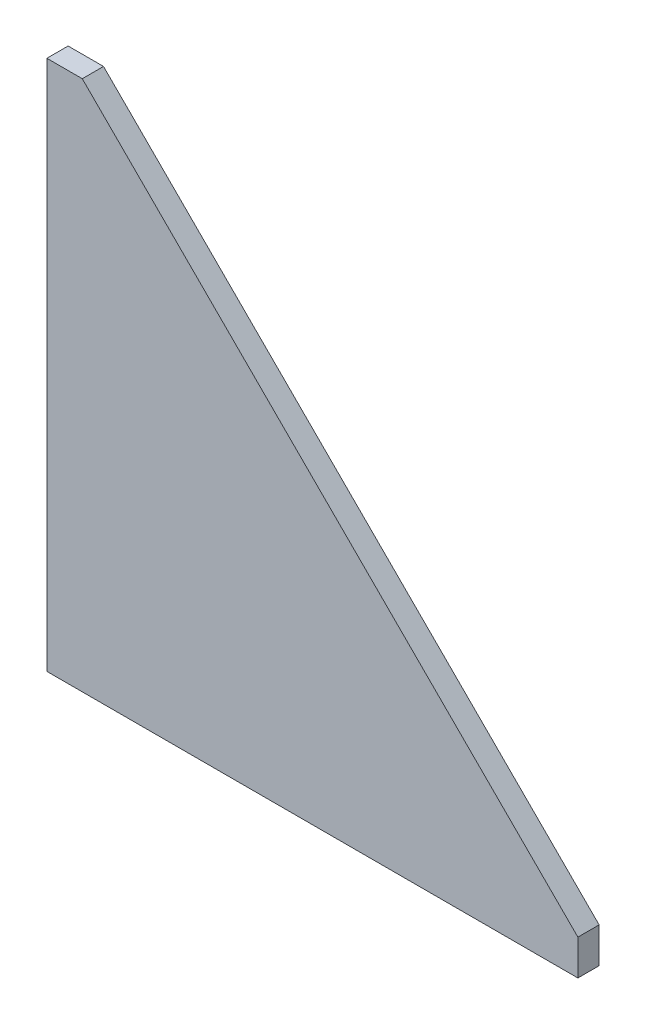
from build123d import *

# Parameters (mm, degrees)
SM_BASE_FLANGE_1_DEPTH = 6


# Sheet-metal steps are written as plain solids
with BuildPart() as part:
    # Sketch 1 → Базовая кромка1 (new body)
    with BuildSketch(Plane.XY):
        Polygon((0, 0), (150, 0), (150, 10), (10, 150), (0, 150), align=None)
    extrude(amount=-SM_BASE_FLANGE_1_DEPTH)


solid = part.part
